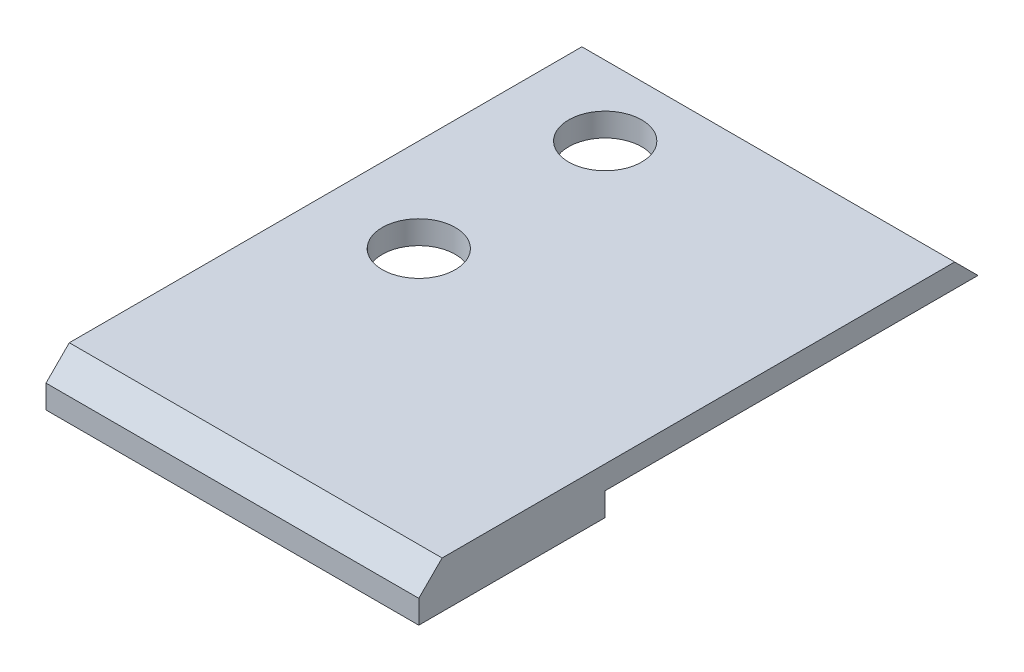
from build123d import *

# Parameters (mm, degrees)
SKETCH1_W           = 25.4
SKETCH1_H           = 25.4
SKETCH1_R           = 2.4892
BOSS_EXTRUDE1_DEPTH = 1.5875
SKETCH1_3_W         = 25.4
SKETCH1_3_H         = 12.7
BOSS_EXTRUDE2_DEPTH = 3.175
CHAMFER1_SIZE       = 1.5875


with BuildPart() as part:
    # Sketch1 → Boss-Extrude1 (new body)
    with BuildSketch(Plane(origin=(0, 0, 0), x_dir=(1, 0, 0), z_dir=(0, 1, 0))):
        with Locations((12.7, 25.4)):
            Rectangle(SKETCH1_W, SKETCH1_H)
        with Locations(Location((6.35, 19.05, 0), (0, 0, 270))):
            Circle(SKETCH1_R, mode=Mode.SUBTRACT)
        with Locations(Location((6.35, 31.75, 0), (0, 0, 270))):
            Circle(SKETCH1_R, mode=Mode.SUBTRACT)
    extrude(amount=-BOSS_EXTRUDE1_DEPTH)

    # Sketch1<3> → Boss-Extrude2 (add)
    with BuildSketch(Plane(origin=(0, 0, 0), x_dir=(1, 0, 0), z_dir=(0, 1, 0))):
        with Locations((12.7, 6.35)):
            Rectangle(SKETCH1_3_W, SKETCH1_3_H)
    extrude(amount=-BOSS_EXTRUDE2_DEPTH)

    # Chamfer1
    chamfer1_edges = [part.edges().sort_by_distance(p)[0] for p in [
        (12.7, 0, -38.1),
        (12.7, 0, 0),
    ]]
    chamfer(chamfer1_edges, length=CHAMFER1_SIZE - 0.0001)  # a hair under: the kernel refuses the full size


solid = part.part
